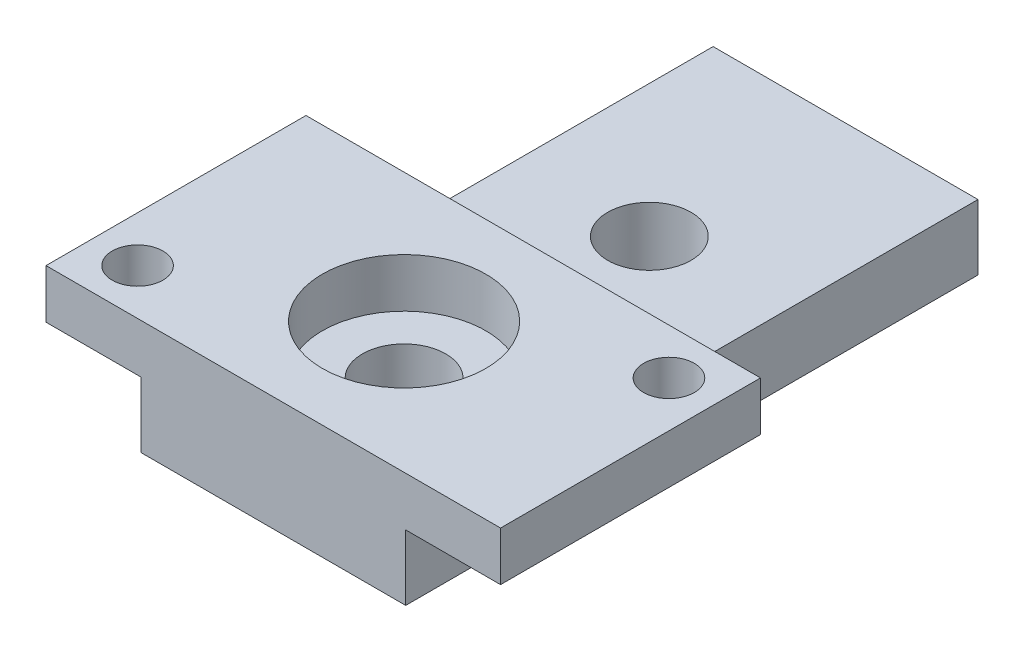
from build123d import *

# Parameters (mm, degrees)
SKETCH1_W           = 27.8
SKETCH1_H           = 15.9
SKETCH1_R           = 1.55
BOSS_EXTRUDE1_DEPTH = 3
SKETCH2_W           = 16.2
SKETCH2_H           = 35
BOSS_EXTRUDE2_DEPTH = 4
SKETCH3_R           = 2.55
CUT_EXTRUDE1_DEPTH  = 4
SKETCH4_R           = 5
CUT_EXTRUDE4_DEPTH  = 3


with BuildPart() as part:
    # Sketch1 → Boss-Extrude1 (new body)
    with BuildSketch(Plane(origin=(0, 0, 0), x_dir=(1, 0, 0), z_dir=(0, 1, 0))):
        with Locations((13.9, 7.95)):
            Rectangle(SKETCH1_W, SKETCH1_H)
        with Locations((2.8, 2.8)):
            Circle(SKETCH1_R, mode=Mode.SUBTRACT)
        with Locations((25, 13.1)):
            Circle(SKETCH1_R, mode=Mode.SUBTRACT)
    extrude(amount=BOSS_EXTRUDE1_DEPTH)

    # Sketch2 → Boss-Extrude2 (add)
    with BuildSketch(Plane.XZ):
        with Locations((13.9, -17.5)):
            Rectangle(SKETCH2_W, SKETCH2_H)
    extrude(amount=BOSS_EXTRUDE2_DEPTH)

    # Sketch3 → Cut-Extrude1 (cut)
    with BuildSketch(Plane.XZ.offset(4)):
        with Locations((13.9, -8)):
            Circle(SKETCH3_R)
        with Locations((13.9, -23)):
            Circle(SKETCH3_R)
    extrude(amount=-CUT_EXTRUDE1_DEPTH, mode=Mode.SUBTRACT)

    # Sketch4 → Cut-Extrude4 (cut)
    with BuildSketch(Plane(origin=(0, 3, 0), x_dir=(1, 0, 0), z_dir=(0, 1, 0))):
        with Locations((13.9, 8)):
            Circle(SKETCH4_R)
    extrude(amount=-CUT_EXTRUDE4_DEPTH, mode=Mode.SUBTRACT)


solid = part.part
